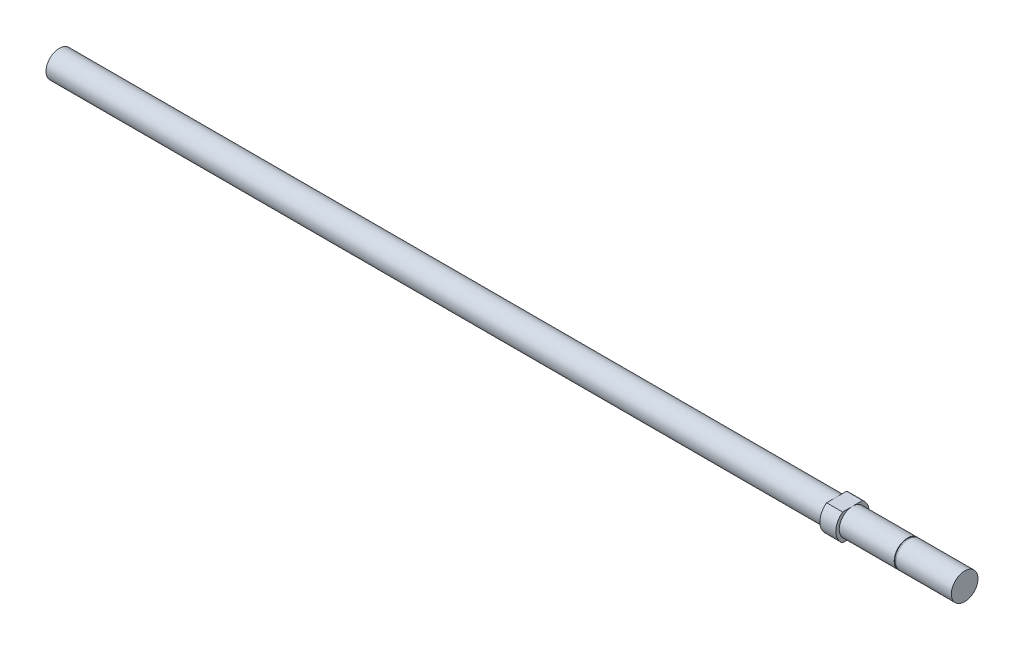
from build123d import *

# Parameters (mm, degrees)
SKETCH2_OUTSIDE_W   = 53.074
SKETCH2_OUTSIDE_H   = 53.074
SKETCH2_OUTSIDE_W_2 = 7.9375
SKETCH2_OUTSIDE_H_2 = 6.35
CUT_EXTRUDE1_DEPTH  = 216.465114617


with BuildPart() as part:
    # Sketch1 → Revolve1 (revolve)
    with BuildSketch(Plane.XY):
        Polygon((0, 0), (-215.392, 0), (-215.392, 3.175), (-30.48, 3.175), (-30.48, 3.96875), (-26.67, 3.96875), (-26.67, 3.175), (-13.589, 3.175), (-13.589, 3.0226), (-13.208, 3.0226), (-13.208, 3.175), (0, 3.175), align=None)
    revolve(axis=Axis((0, 0, 0), (-1, 0, 0)))

    # Sketch2 outside → Cut-Extrude1 (cut, through all)
    with BuildSketch(Plane(origin=(0, 0, 0), x_dir=(0, 0, -1), z_dir=(1, 0, 0))):
        Rectangle(SKETCH2_OUTSIDE_W, SKETCH2_OUTSIDE_H)
        Rectangle(SKETCH2_OUTSIDE_W_2, SKETCH2_OUTSIDE_H_2, mode=Mode.SUBTRACT)
    extrude(amount=-CUT_EXTRUDE1_DEPTH, mode=Mode.SUBTRACT)


solid = part.part
